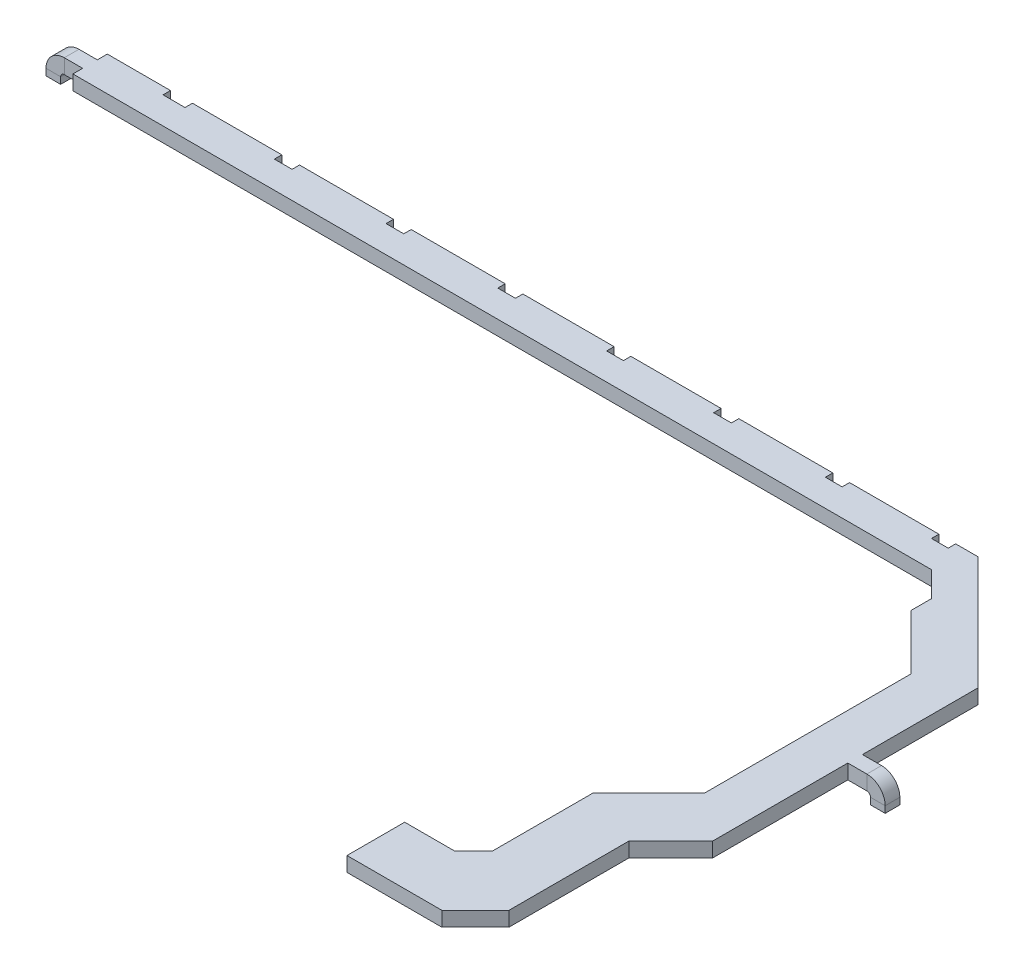
from build123d import *

# Parameters (mm, degrees)
BOSS_EXTRUDE1_DEPTH = 2
EDGE_FLANGE1_DEPTH  = 2
EDGE_FLANGE2_DEPTH  = 2
CUT_EXTRUDE3_DEPTH  = 10


# Sheet-metal steps are written as plain solids
with BuildPart() as part:
    # Sketch2 → Boss-Extrude1 (new body)
    with BuildSketch(Plane(origin=(0, 0, 0), x_dir=(1, 0, 0), z_dir=(0, 1, 0))):
        Polygon((81.609993248, 1.669814581), (81.609993248, -16.836643227), (75.909994488, -22.536641987), (75.909994488, -38.936642207), (70.009993588, -44.836643107), (58.109994528, -44.836643107), (58.109994528, -34.336641247), (63.809993288, -34.336641247), (67.509993508, -30.636641027), (67.509993508, -19.345596807), (75.109993548, -11.745596767), (75.109993548, 16.463358753), (67.709993108, 23.863356653), (67.709993108, 26.763358473), (64.309994828, 30.163356753), (-43.190006072, 30.163356753), (-52.793309772, 30.163356753), (-52.793309772, 31.563357033), (-54.793309772, 31.563357033), (-54.793309772, 33.563357033), (-52.793309772, 33.563357033), (-52.793309772, 34.963357313), (-43.190006072, 34.963357313), (66.209993568, 34.963357313), (81.609993248, 19.563357633), (81.609993248, 3.669814581), (83.609993248, 3.669814581), (83.609993248, 1.669814581), align=None)
    extrude(amount=BOSS_EXTRUDE1_DEPTH)

    # Edge-Flange1 section (across the edge) → Edge-Flange1 (add)
    with BuildSketch(Plane(origin=(-55.793309772, 0, -31.563357033), x_dir=(1, 0, 0), z_dir=(0, 0, -1))):
        with BuildLine():
            Line((-2, 0.5), (-2, 1.4))
            Line((-2, 1.4), (0, 1.4))
            Line((0, 1.4), (0, 0.5))
            ThreePointArc((0, 0.5), (0.146446609, 0.146446609), (0.5, 0))
            Line((0.5, 0), (1, 0))
            Line((1, 0), (1, -2))
            Line((1, -2), (0.5, -2))
            ThreePointArc((0.5, -2), (-1.267766953, -1.267766953), (-2, 0.5))
        make_face()
    extrude(amount=EDGE_FLANGE1_DEPTH)

    # Edge-Flange2 section (across the edge) → Edge-Flange2 (add)
    with BuildSketch(Plane(origin=(84.609993248, 0, -3.669814581), x_dir=(-1, 0, 0), z_dir=(0, 0, 1))):
        with BuildLine():
            Line((-2, 0.5), (-2, 1.4))
            Line((-2, 1.4), (0, 1.4))
            Line((0, 1.4), (0, 0.5))
            ThreePointArc((0, 0.5), (0.146446609, 0.146446609), (0.5, 0))
            Line((0.5, 0), (1, 0))
            Line((1, 0), (1, -2))
            Line((1, -2), (0.5, -2))
            ThreePointArc((0.5, -2), (-1.267766953, -1.267766953), (-2, 0.5))
        make_face()
    extrude(amount=EDGE_FLANGE2_DEPTH)

    # Sketch13 → Cut-Extrude3 (cut)
    with BuildSketch(Plane(origin=(0, 2, 0), x_dir=(1, 0, 0), z_dir=(0, 1, 0))):
        Polygon((64.364993832, 30.231358373), (-43.077006168, 30.231358373), (-52.793309772, 30.231358373), (-52.793309772, 30.163356753), (64.309994828, 30.163356753), (67.709993108, 26.763358473), (67.709993108, 23.863356653), (75.109993548, 16.463358753), (75.109993548, -11.745596767), (67.509993508, -19.345596807), (67.509993508, -30.636641027), (63.809993288, -34.336641247), (58.109994528, -34.336641247), (58.109994528, -44.836643107), (70.009993588, -44.836643107), (75.909994488, -38.936642207), (75.909994488, -22.536641987), (81.609993248, -16.836643227), (81.609993248, 1.669814581), (81.509993832, 1.669814581), (81.509993832, -16.758641627), (75.794993832, -22.473641627), (75.794993832, -38.856641627), (71.222993832, -43.428641627), (58.268993832, -43.428641627), (58.268993832, -35.554641627), (65.126993832, -35.554641627), (67.665284412, -33.016351047), (67.669899592, -19.298575587), (75.286993832, -11.672504987), (75.286993832, 16.515358373), (67.793993832, 24.008355833), (67.793993832, 26.802358373), align=None)
        Polygon((-52.793309772, 30.163356753), (-52.793309772, 30.231358373), (-53.09278865, 30.231358373), (-53.09278865, 29.122247983), (64.073173088, 29.122247983), (66.904295046, 26.802358373), (66.904295046, 23.685270997), (74.890508664, 15.670381273), (73.855495628, -9.951608799), (66.571415804, -17.811521066), (66.392045366, -24.291741654), (65.126993832, -32.125935595), (57.650093481, -33.249786732), (57.276841603, -46.73447534), (58.268993832, -46.73447534), (69.513593476, -46.73447534), (76.944541222, -41.148796497), (77.641700893, -23.890445583), (84.109993248, -17.212504202), (84.109993248, 1.669814581), (81.609993248, 1.669814581), (81.609993248, -16.836643227), (75.909994488, -22.536641987), (75.909994488, -38.936642207), (70.009993588, -44.836643107), (58.109994528, -44.836643107), (58.109994528, -34.336641247), (63.809993288, -34.336641247), (67.509993508, -30.636641027), (67.509993508, -19.345596807), (75.109993548, -11.745596767), (75.109993548, 16.463358753), (67.709993108, 23.863356653), (67.709993108, 26.763358473), (64.309994828, 30.163356753), align=None)
        Polygon((84.109993248, 19.032357692), (84.109993248, 3.669814581), (81.509993832, 3.669814581), (81.509993832, 19.436358373), (66.015993832, 34.930358373), (62.967993832, 34.930358373), (62.967993832, 33.914358373), (60.681993832, 33.914358373), (60.681993832, 34.930358373), (48.489993832, 34.930358373), (48.489993832, 33.914358373), (46.203993832, 33.914358373), (46.203993832, 34.930358373), (33.376993832, 34.930358373), (33.376993832, 33.914358373), (30.963993832, 33.914358373), (30.963993832, 34.930358373), (18.644993832, 34.930358373), (18.644993832, 33.914358373), (16.358993832, 33.914358373), (16.358993832, 34.930358373), (3.912993832, 34.930358373), (3.912993832, 33.914358373), (1.499993832, 33.914358373), (1.499993832, 34.930358373), (-11.327006168, 34.930358373), (-11.327006168, 33.914358373), (-13.740006168, 33.914358373), (-13.740006168, 34.930358373), (-26.567006168, 34.930358373), (-26.567006168, 33.914358373), (-28.980006168, 33.914358373), (-28.980006168, 34.930358373), (-41.172006168, 34.930358373), (-41.172006168, 33.914358373), (-44.172006168, 33.914358373), (-44.172006168, 34.930358373), (-54.307784522, 34.930358373), (-54.307784522, 35.697895733), (66.904295046, 35.697895733), align=None)
    extrude(amount=-CUT_EXTRUDE3_DEPTH, mode=Mode.SUBTRACT)


solid = part.part
